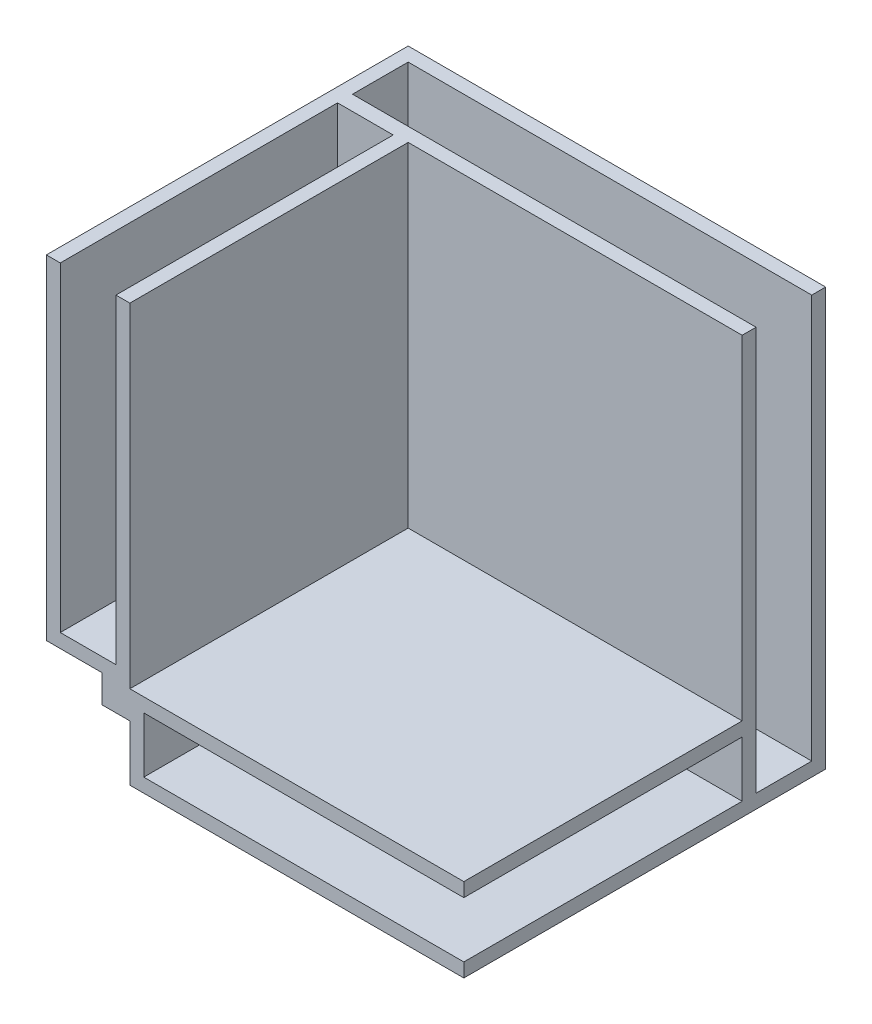
from build123d import *

# Parameters (mm, degrees)
SKETCH1_W           = 30
SKETCH1_H           = 30
BOSS_EXTRUDE1_DEPTH = 6
BOSS_EXTRUDE4_DEPTH = 20
SKETCH4_W           = 2
SKETCH4_H           = 2
BOSS_EXTRUDE6_DEPTH = 20
SKETCH5_W           = 24
SKETCH5_H           = 6
BOSS_EXTRUDE7_DEPTH = 20
SHELL2_START        = 7
SHELL2_DEPTH        = 23
SHELL2_START_2      = 1
SHELL2_2_DEPTH      = 4
SHELL2_START_3      = 5
SHELL2_3_OUTLINE_W  = 29
SHELL2_3_OUTLINE_H  = 4
SHELL2_3_DEPTH      = 2
SKETCH7_W           = 23
SKETCH7_H           = 1
BOSS_EXTRUDE8_DEPTH = 5
SKETCH9_W           = 1.075143629
SKETCH9_H           = 23
BOSS_EXTRUDE9_DEPTH = 5
SKETCH10_W          = 4
SKETCH10_H          = 23
CUT_EXTRUDE1_DEPTH  = 10
SKETCH11_W          = 23
SKETCH11_H          = 4
CUT_EXTRUDE2_DEPTH  = 10


# Read off the part's stored shape, not the designer's step: Shell2
with BuildPart() as part:
    # Sketch1 → Boss-Extrude1 (new body)
    with BuildSketch(Plane.XY):
        with Locations((15, 15)):
            Rectangle(SKETCH1_W, SKETCH1_H)
    extrude(amount=BOSS_EXTRUDE1_DEPTH)

    # Sketch2 → Boss-Extrude4 (add)
    with BuildSketch(Plane.XY.offset(6)):
        Polygon((5, 6), (6, 6), (6, 30), (0, 30), (0, 6), align=None)
    extrude(amount=BOSS_EXTRUDE4_DEPTH)

    # Sketch4 → Boss-Extrude6 (add)
    with BuildSketch(Plane.XY.offset(6)):
        with Locations((5, 5)):
            Rectangle(SKETCH4_W, SKETCH4_H)
    extrude(amount=BOSS_EXTRUDE6_DEPTH)

    # Sketch5 → Boss-Extrude7 (add)
    with BuildSketch(Plane.XY.offset(6)):
        with Locations((18, 3)):
            Rectangle(SKETCH5_W, SKETCH5_H)
    extrude(amount=BOSS_EXTRUDE7_DEPTH)

    # Shell2 outline → Shell2 (cut)
    with BuildSketch(Plane(origin=(0, 0, 0), x_dir=(1, 0, 0), z_dir=(0, 1, 0)).offset(SHELL2_START)):
        Polygon((5, -5), (30, -5), (30, -1), (1, -1), (1, -25), (5, -25), align=None)
    extrude(amount=SHELL2_DEPTH, mode=Mode.SUBTRACT)

    # Shell2 2 outline → Shell2 2 (cut)
    with BuildSketch(Plane(origin=(0, 0, 0), x_dir=(1, 0, 0), z_dir=(0, 1, 0)).offset(SHELL2_START_2)):
        Polygon((7, -5), (7, -25), (30, -25), (30, -1), (1, -1), (1, -5), align=None)
    extrude(amount=SHELL2_2_DEPTH, mode=Mode.SUBTRACT)

    # Shell2 3 outline → Shell2 3 (cut)
    with BuildSketch(Plane(origin=(0, 0, 0), x_dir=(1, 0, 0), z_dir=(0, 1, 0)).offset(SHELL2_START_3)):
        with Locations((15.5, -3)):
            Rectangle(SHELL2_3_OUTLINE_W, SHELL2_3_OUTLINE_H)
    extrude(amount=SHELL2_3_DEPTH, mode=Mode.SUBTRACT)

    # Sketch7 → Boss-Extrude8 (add)
    with BuildSketch(Plane.XZ.offset(-5)):
        with Locations((18.5, 5.5)):
            Rectangle(SKETCH7_W, SKETCH7_H)
    extrude(amount=BOSS_EXTRUDE8_DEPTH)

    # Sketch9 → Boss-Extrude9 (add)
    with BuildSketch(Plane.ZY.offset(-5)):
        with Locations((5.537571814, 18.5)):
            Rectangle(SKETCH9_W, SKETCH9_H)
    extrude(amount=BOSS_EXTRUDE9_DEPTH)

    # Sketch10 → Cut-Extrude1 (cut)
    with BuildSketch(Plane.XY.offset(26)):
        with Locations((3, 18.5)):
            Rectangle(SKETCH10_W, SKETCH10_H)
    extrude(amount=-CUT_EXTRUDE1_DEPTH, mode=Mode.SUBTRACT)

    # Sketch11 → Cut-Extrude2 (cut)
    with BuildSketch(Plane.XY.offset(26)):
        with Locations((18.5, 3)):
            Rectangle(SKETCH11_W, SKETCH11_H)
    extrude(amount=-CUT_EXTRUDE2_DEPTH, mode=Mode.SUBTRACT)


solid = part.part
